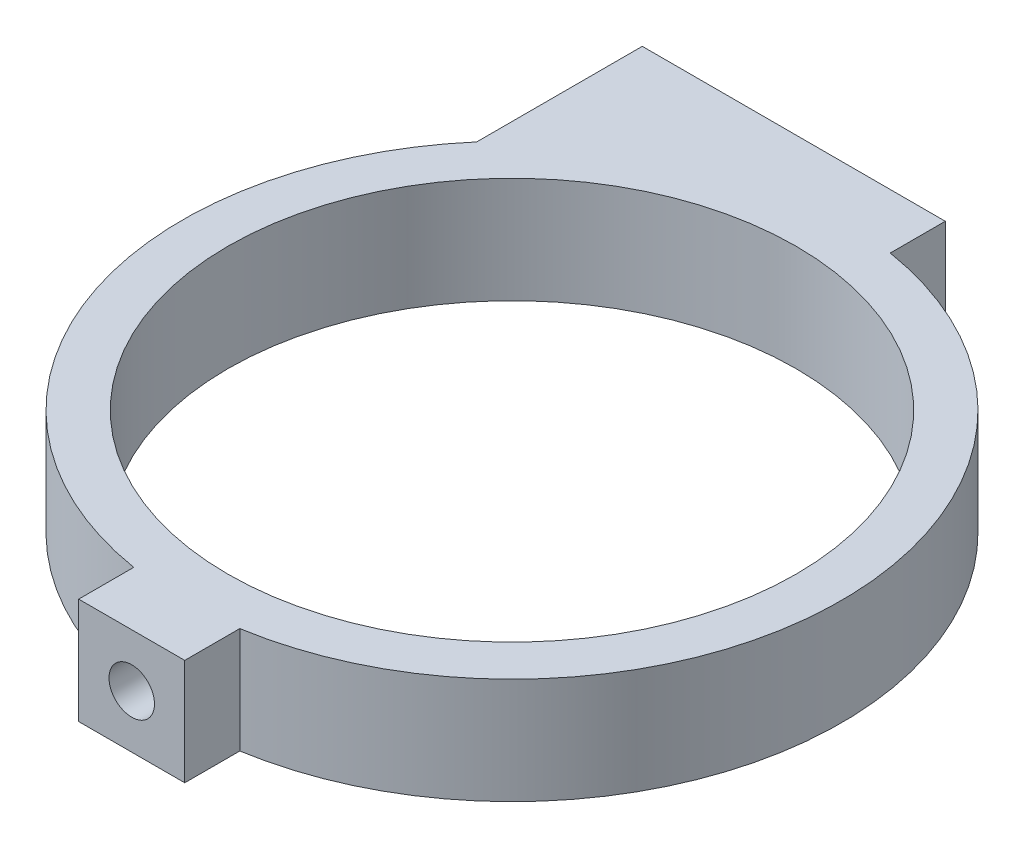
from build123d import *

# Parameters (mm, degrees)
SKETCH1_R           = 18.75
BOSS_EXTRUDE1_DEPTH = 7
SKETCH2_R           = 1.5
CUT_EXTRUDE1_DEPTH  = 7
SKETCH3_R           = 1.4
CUT_EXTRUDE2_DEPTH  = 5
BOSS_EXTRUDE3_DEPTH = 7
SKETCH7_R           = 1.4
CUT_EXTRUDE3_DEPTH  = 7


with BuildPart() as part:
    # Sketch1 → Boss-Extrude1 (new body)
    with BuildSketch(Plane(origin=(0, 0, 0), x_dir=(1, 0, 0), z_dir=(0, 1, 0))):
        with BuildLine():
            Line((3.5, -25.1), (-3.5, -25.1))
            Line((-3.5, -25.1), (-3.5, -21.466543737))
            ThreePointArc((-3.5, -21.466543737), (-21.75, 0), (-3.5, 21.466543737))
            Line((-3.5, 21.466543737), (-3.5, 25.1))
            Line((-3.5, 25.1), (3.5, 25.1))
            Line((3.5, 25.1), (3.5, 21.466543737))
            ThreePointArc((3.5, 21.466543737), (21.75, 0), (3.5, -21.466543737))
            Line((3.5, -21.466543737), (3.5, -25.1))
        make_face()
        Circle(SKETCH1_R, mode=Mode.SUBTRACT)
    extrude(amount=BOSS_EXTRUDE1_DEPTH)

    # Sketch2 → Cut-Extrude1 (cut)
    with BuildSketch(Plane.XY.offset(25.1)):
        with Locations((0, 3.5)):
            Circle(SKETCH2_R)
    extrude(amount=-CUT_EXTRUDE1_DEPTH, mode=Mode.SUBTRACT)

    # Sketch3 → Cut-Extrude2 (cut)
    with BuildSketch(Plane(origin=(0, 0, -25.1), x_dir=(-1, 0, 0), z_dir=(0, 0, -1))):
        with Locations((0, 3.5)):
            Circle(SKETCH3_R)
    extrude(amount=-CUT_EXTRUDE2_DEPTH, mode=Mode.SUBTRACT)

    # Sketch6 → Boss-Extrude3 (add)
    with BuildSketch(Plane(origin=(0, 0, 0), x_dir=(-1, 0, 0), z_dir=(0, -1, 0))):
        with BuildLine():
            Line((3.5, 25.1), (16.5, 25.1))
            Line((16.5, 25.1), (16.5, 14.170832721))
            ThreePointArc((16.5, 14.170832721), (10.644569029, 18.967225685), (3.5, 21.466543737))
            Line((3.5, 21.466543737), (3.5, 25.1))
        make_face()
    extrude(amount=-BOSS_EXTRUDE3_DEPTH)

    # Sketch7 → Cut-Extrude3 (cut)
    with BuildSketch(Plane(origin=(0, 0, -25.1), x_dir=(-1, 0, 0), z_dir=(0, 0, -1))):
        with Locations((10, 3.5)):
            Circle(SKETCH7_R)
    extrude(amount=-CUT_EXTRUDE3_DEPTH, mode=Mode.SUBTRACT)


solid = part.part
